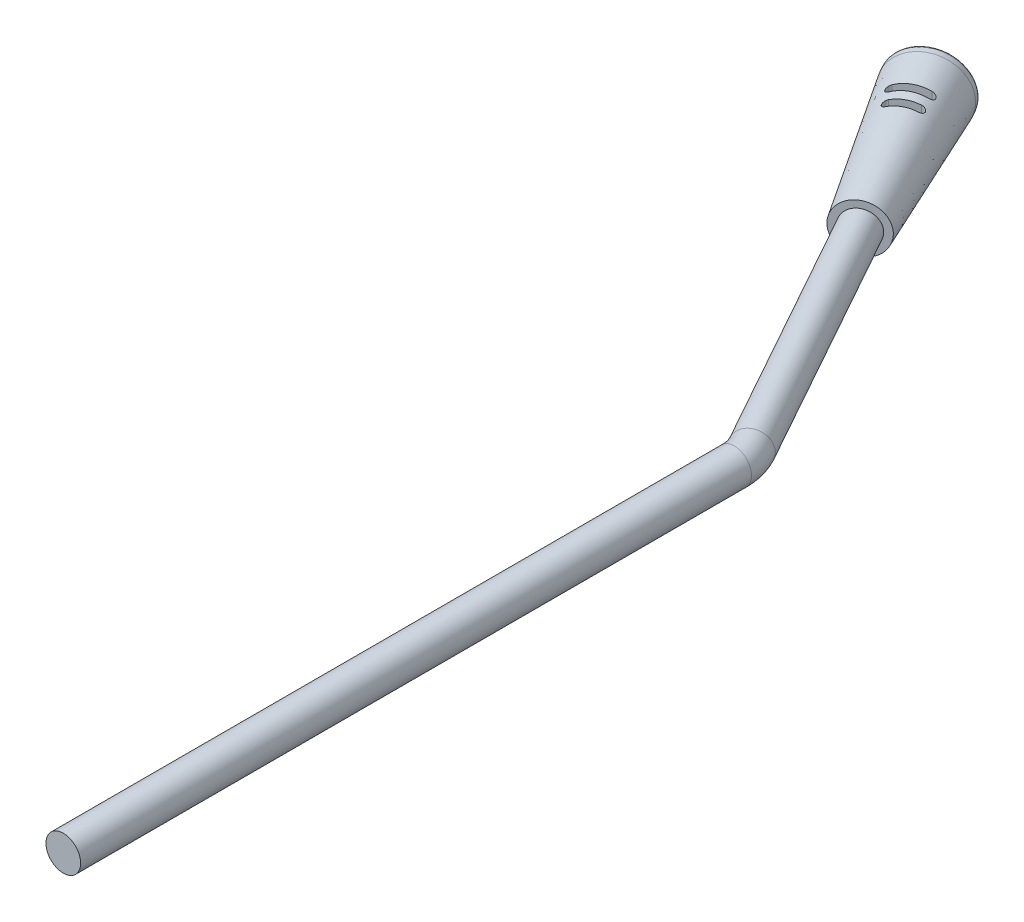
from build123d import *

# Parameters (mm, degrees)
IZIM1_R                           = 3.55
IZIM3_R                           = 5
Y_KSEKLIK_EKSTR_ZYON1_DEPTH       = 35
Y_KSEKLIK_EKSTR_ZYON1_DRAFT       = -4
KES_EKSTR_ZYON1_REACH             = 234.785
KES_EKSTR_ZYON1_DIRECTION_2_REACH = 234.785
IZIM5_R                           = 7.447438418
Y_KSEKLIK_EKSTR_ZYON2_DEPTH       = 2.5
KES_EKSTR_ZYON2_START             = -2.5
KES_EKSTR_ZYON2_DEPTH             = 2.5
SCALE1_SCALE                      = 0.35


# Read off the part's stored shape, not the designer's step: Kes-Ekstrüzyon2
with BuildPart() as part:
    # Süpür1: sweep along a path in Çizim2
    with BuildLine(Plane(origin=(0, 0, 0), x_dir=(1, 0, 0), z_dir=(0, 1, 0))) as s_p_r1_path:
        Line((0, 0), (0, 137.401052942))
        ThreePointArc((0, 137.401052942), (-0.321526794, 139.916436889), (-1.265431279, 142.270068168))
        Line((-1.265431279, 142.270068168), (-29.214091353, 192.407412323))
    # Çizim1 → Süpür1 (sweep)
    with BuildSketch(Plane.XY):
        Circle(IZIM1_R)
    sweep(path=s_p_r1_path.line)


with BuildPart() as y_kseklik_ekstr_zyon1_tool:
    # Çizim3 → Yükseklik-Ekstrüzyon1 (with draft: the straight prism first)
    with BuildSketch(Plane(origin=(-88.754338678, 0, -159.21717935), x_dir=(-0.8734568720516385, 0, 0.48690152255437436), z_dir=(-0.48690152255437436, 0, -0.8734568720516385))):
        with Locations((-68.166213158, 0)):
            Circle(IZIM3_R)
    extrude(amount=Y_KSEKLIK_EKSTR_ZYON1_DEPTH)
    # Yükseklik-Ekstrüzyon1: the draft: its side faces are tilted about the plane it starts from
    y_kseklik_ekstr_zyon1_sides = [y_kseklik_ekstr_zyon1_tool.faces().sort_by_distance(p)[0] for p in [
        (-33.367583638, 0, -210.127415197),
    ]]
    draft(y_kseklik_ekstr_zyon1_sides, Plane(origin=(-88.754338678, 0, -159.21717935), x_dir=(-0.8734568720516385, 0, 0.48690152255437436), z_dir=(-0.48690152255437436, 0, -0.8734568720516385)), Y_KSEKLIK_EKSTR_ZYON1_DRAFT)


with BuildPart() as part_1:
    add(part.part)

    # Yükseklik-Ekstrüzyon1: add y_kseklik_ekstr_zyon1_tool
    add(y_kseklik_ekstr_zyon1_tool.part)

    # Kes-Ekstrüzyon1: up to this cone (the profile starts inside it)
    kes_ekstr_zyon1_end = Plane(origin=(-41.287705224, 0, -214.066373154), z_dir=(-0.48690152255437436, 0, -0.8734568720516385)).offset(-96.300159439) * Cone(1e-06, 23.785643459, 340.150547806, align=(Align.CENTER, Align.CENTER, Align.MIN), mode=Mode.PRIVATE)
    # Çizim4 → Kes-Ekstrüzyon1 (cut, up to the surface)
    with BuildSketch(Plane(origin=(0, 0, 0), x_dir=(1, 0, 0), z_dir=(0, 1, 0)), mode=Mode.PRIVATE) as kes_ekstr_zyon1_sk1:
        with BuildLine():
            Line((-45.209229303, 214.939819091), (-39.968488071, 217.861228226))
            ThreePointArc((-39.968488071, 217.861228226), (-38.824578975, 217.536178458), (-39.149628743, 216.392269362))
            Line((-39.149628743, 216.392269362), (-44.390369975, 213.470860227))
            ThreePointArc((-44.390369975, 213.470860227), (-45.534279071, 213.795909995), (-45.209229303, 214.939819091))
        make_face()
    kes_ekstr_zyon1_tool1 = extrude(kes_ekstr_zyon1_sk1.sketch, amount=-KES_EKSTR_ZYON1_REACH, mode=Mode.PRIVATE) & kes_ekstr_zyon1_end
    add(kes_ekstr_zyon1_tool1.solids().sort_by_distance((-42.179429, 0, -215.666044))[0], mode=Mode.SUBTRACT)
    # Çizim4 → Kes-Ekstrüzyon1 (cut, up to the surface)
    with BuildSketch(Plane(origin=(0, 0, 0), x_dir=(1, 0, 0), z_dir=(0, 1, 0)), mode=Mode.PRIVATE) as kes_ekstr_zyon1_sk2:
        with BuildLine():
            Line((-42.979838494, 211.967397244), (-38.612554134, 214.401904857))
            ThreePointArc((-38.612554134, 214.401904857), (-37.494390623, 214.084170877), (-37.812124603, 212.966007366))
            Line((-37.812124603, 212.966007366), (-42.179408963, 210.531499753))
            ThreePointArc((-42.179408963, 210.531499753), (-43.297572474, 210.849233733), (-42.979838494, 211.967397244))
        make_face()
    kes_ekstr_zyon1_tool2 = extrude(kes_ekstr_zyon1_sk2.sketch, amount=-KES_EKSTR_ZYON1_REACH, mode=Mode.PRIVATE) & kes_ekstr_zyon1_end
    add(kes_ekstr_zyon1_tool2.solids().sort_by_distance((-40.395982, 0, -212.466702))[0], mode=Mode.SUBTRACT)

    # Kes-Ekstrüzyon1 direction 2: up to this cone (the profile starts inside it)
    kes_ekstr_zyon1_direction_2_end = Plane(origin=(-41.287705224, 0, -214.066373154), z_dir=(-0.48690152255437436, 0, -0.8734568720516385)).offset(-96.300159439) * Cone(1e-06, 23.785643459, 340.150547806, align=(Align.CENTER, Align.CENTER, Align.MIN), mode=Mode.PRIVATE)
    # Çizim4 → Kes-Ekstrüzyon1 direction 2 (cut, up to the surface)
    with BuildSketch(Plane(origin=(0, 0, 0), x_dir=(1, 0, 0), z_dir=(0, 1, 0)), mode=Mode.PRIVATE) as kes_ekstr_zyon1_direction_2_sk1:
        with BuildLine():
            Line((-45.209229303, 214.939819091), (-39.968488071, 217.861228226))
            ThreePointArc((-39.968488071, 217.861228226), (-38.824578975, 217.536178458), (-39.149628743, 216.392269362))
            Line((-39.149628743, 216.392269362), (-44.390369975, 213.470860227))
            ThreePointArc((-44.390369975, 213.470860227), (-45.534279071, 213.795909995), (-45.209229303, 214.939819091))
        make_face()
    kes_ekstr_zyon1_direction_2_tool1 = extrude(kes_ekstr_zyon1_direction_2_sk1.sketch, amount=KES_EKSTR_ZYON1_DIRECTION_2_REACH, mode=Mode.PRIVATE) & kes_ekstr_zyon1_direction_2_end
    add(kes_ekstr_zyon1_direction_2_tool1.solids().sort_by_distance((-42.179429, 0, -215.666044))[0], mode=Mode.SUBTRACT)
    # Çizim4 → Kes-Ekstrüzyon1 direction 2 (cut, up to the surface)
    with BuildSketch(Plane(origin=(0, 0, 0), x_dir=(1, 0, 0), z_dir=(0, 1, 0)), mode=Mode.PRIVATE) as kes_ekstr_zyon1_direction_2_sk2:
        with BuildLine():
            Line((-42.979838494, 211.967397244), (-38.612554134, 214.401904857))
            ThreePointArc((-38.612554134, 214.401904857), (-37.494390623, 214.084170877), (-37.812124603, 212.966007366))
            Line((-37.812124603, 212.966007366), (-42.179408963, 210.531499753))
            ThreePointArc((-42.179408963, 210.531499753), (-43.297572474, 210.849233733), (-42.979838494, 211.967397244))
        make_face()
    kes_ekstr_zyon1_direction_2_tool2 = extrude(kes_ekstr_zyon1_direction_2_sk2.sketch, amount=KES_EKSTR_ZYON1_DIRECTION_2_REACH, mode=Mode.PRIVATE) & kes_ekstr_zyon1_direction_2_end
    add(kes_ekstr_zyon1_direction_2_tool2.solids().sort_by_distance((-40.395982, 0, -212.466702))[0], mode=Mode.SUBTRACT)

    # Çizim5 → Yükseklik-Ekstrüzyon2 (add)
    with BuildSketch(Plane(origin=(-105.795891967, 0, -189.788169872), x_dir=(-0.8734568720516382, 0, 0.4869015225543744), z_dir=(-0.4869015225543744, 0, -0.8734568720516382))):
        with Locations((-68.166213158, 0)):
            Circle(IZIM5_R)
    extrude(amount=Y_KSEKLIK_EKSTR_ZYON2_DEPTH)

    # Çizim6 → Kes-Döndür1 (revolve, cut)
    with BuildSketch(Plane(origin=(0, 0, 0), x_dir=(1, 0, 0), z_dir=(0, 1, 0)), mode=Mode.PRIVATE) as kes_d_nd_r1_sk:
        with BuildLine():
            Line((-39.750628377, 226.60457195), (-40.325275653, 227.635436692))
            ThreePointArc((-40.325275653, 227.635436692), (-40.577901157, 227.856858074), (-40.91362857, 227.868441612))
            Line((-40.91362857, 227.868441612), (-44.885136864, 226.60457195))
            Line((-44.885136864, 226.60457195), (-47.472898449, 225.162045025))
            Line((-47.472898449, 225.162045025), (-47.961241176, 226.038087286))
            Line((-47.961241176, 226.038087286), (-40.325275653, 230.294694977))
            Line((-40.325275653, 230.294694977), (-38.62051319, 227.236506781))
            Line((-38.62051319, 227.236506781), (-39.750628377, 226.60457195))
        make_face()
    revolve(kes_d_nd_r1_sk.sketch.rotate(Axis((-47.472898449, 0, -225.162045025), (0.4869015225543754, 0, 0.8734568720516378)), 180), axis=Axis((-47.472898449, 0, -225.162045025), (0.4869015225543754, 0, 0.8734568720516378)), mode=Mode.SUBTRACT)

    # Kes-Ekstrüzyon2 outline → Kes-Ekstrüzyon2 (cut)
    with BuildSketch(Plane(origin=(-107.013145773, 0, -191.971812052), x_dir=(-0.8734568720516384, 0, 0.4869015225543744), z_dir=(-0.4869015225543744, 0, -0.8734568720516384)).offset(KES_EKSTR_ZYON2_START)):
        with BuildLine():
            ThreePointArc((-67.837962268, 0.557294858), (-67.519455213, -0.005510565), (-67.847505862, -0.562807129))
            Line((-67.847505862, -0.562807129), (-67.793032927, -0.594257092))
            ThreePointArc((-67.793032927, -0.594257092), (-67.464977128, 0.025942373), (-67.837962268, 0.620206683))
            Line((-67.837962268, 0.620206683), (-67.837962268, 0.557294858))
        make_face()
        with BuildLine():
            ThreePointArc((-67.847707098, -0.562921038), (-68.494364419, -0.557353528), (-68.812972077, 0.00539495))
            Line((-68.812972077, 0.00539495), (-68.867445011, -0.026055013))
            ThreePointArc((-68.867445011, -0.026055013), (-68.494364418, -0.620259403), (-67.793223859, -0.594376951))
            Line((-67.793223859, -0.594376951), (-67.847707098, -0.562921038))
        make_face()
        with BuildLine():
            ThreePointArc((-68.812970107, 0.00562618), (-68.484819841, 0.562864093), (-67.838161534, 0.557412179))
            Line((-67.838161534, 0.557412179), (-67.838161534, 0.620312106))
            ThreePointArc((-67.838161534, 0.620312106), (-68.539297927, 0.594317029), (-68.867453346, -0.025829733))
            Line((-68.867453346, -0.025829733), (-68.812970107, 0.00562618))
        make_face()
    extrude(amount=KES_EKSTR_ZYON2_DEPTH, mode=Mode.SUBTRACT)


with BuildPart() as part_2:
    # Scale1: scaled about (0, 0, 0)
    add(part_1.part.scale(SCALE1_SCALE))


solid = part_2.part
